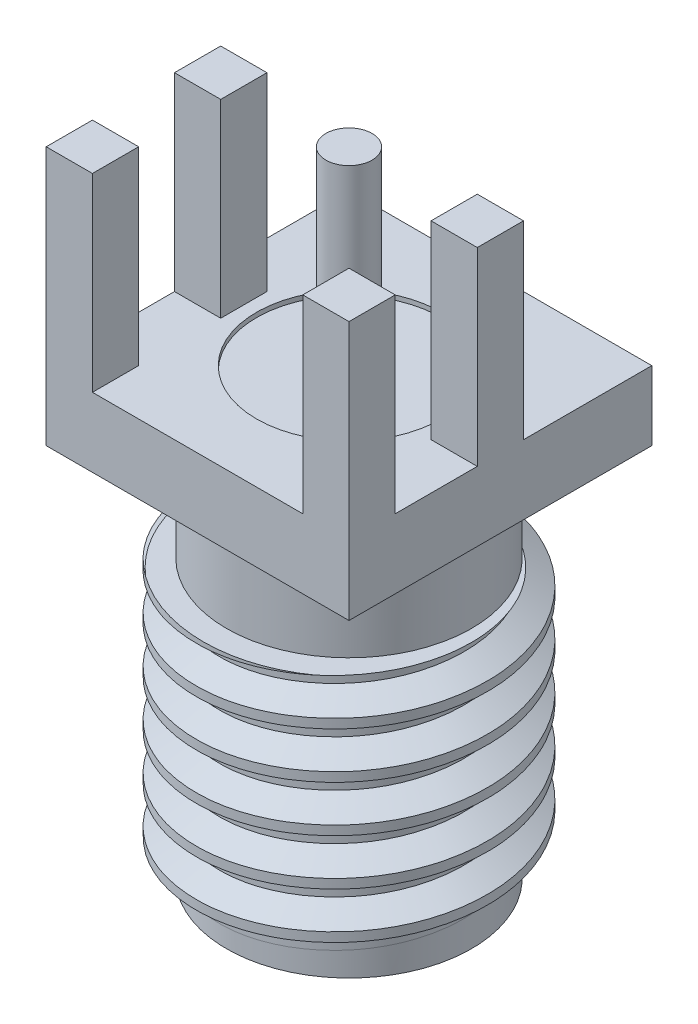
from build123d import *

# Parameters (mm, degrees)
SKETCH1_W           = 6.55
SKETCH1_H           = 6.55
BOSS_EXTRUDE1_DEPTH = 1.5
SKETCH2_W           = 1
SKETCH2_H           = 1
SKETCH2_R           = 0.5
BOSS_EXTRUDE2_DEPTH = 4.1
CUT_EXTRUDE1_START  = -0.1
SKETCH3_R           = 2
SKETCH3_R_2         = 0.5
CUT_EXTRUDE1_DEPTH  = 0.1
SKETCH4_R           = 2.65
BOSS_EXTRUDE3_DEPTH = 8.1
SKETCH5_R           = 2.415
CUT_EXTRUDE2_DEPTH  = 2.25
SKETCH6_R           = 0.25
CUT_EXTRUDE3_DEPTH  = 2
BOSS_EXTRUDE4_START = -6
SKETCH7_R           = 3.15
SKETCH7_R_2         = 2.65
BOSS_EXTRUDE4_DEPTH = 6
CUT_SWEEP3_PITCH    = 1
CUT_EXTRUDE4_START  = -0.8
SKETCH14_R          = 3.15
SKETCH14_R_2        = 2.65
CUT_EXTRUDE4_DEPTH  = 0.8


with BuildPart() as part:
    # Sketch1 → Boss-Extrude1 (new body)
    with BuildSketch(Plane(origin=(0, 0, 0), x_dir=(1, 0, 0), z_dir=(0, 1, 0))):
        Rectangle(SKETCH1_W, SKETCH1_H)
    extrude(amount=BOSS_EXTRUDE1_DEPTH)

    # Sketch2 → Boss-Extrude2 (add)
    with BuildSketch(Plane(origin=(0, 1.5, 0), x_dir=(1, 0, 0), z_dir=(0, 1, 0))):
        with Locations((-2.775, 0)):
            Rectangle(SKETCH2_W, SKETCH2_H)
        with Locations((-2.775, -2.775)):
            Rectangle(SKETCH2_W, SKETCH2_H)
        with Locations((2.775, -2.775)):
            Rectangle(SKETCH2_W, SKETCH2_H)
        with Locations((2.775, 0)):
            Rectangle(SKETCH2_W, SKETCH2_H)
        with Locations(Location((0, 0, 0), (0, 0, 270))):
            Circle(SKETCH2_R)
    extrude(amount=BOSS_EXTRUDE2_DEPTH)

    # Sketch3 → Cut-Extrude1 (cut)
    with BuildSketch(Plane(origin=(0, 1.5, 0), x_dir=(1, 0, 0), z_dir=(0, 1, 0)).offset(CUT_EXTRUDE1_START)):
        with Locations(Location((0, 0, 0), (0, 0, 270))):
            Circle(SKETCH3_R)
        with Locations(Location((0, 0, 0), (0, 0, 270))):
            Circle(SKETCH3_R_2, mode=Mode.SUBTRACT)
    extrude(amount=CUT_EXTRUDE1_DEPTH, mode=Mode.SUBTRACT)

    # Sketch4 → Boss-Extrude3 (add)
    with BuildSketch(Plane.XZ):
        with Locations(Location((0, 0, 0), (0, 0, 90))):
            Circle(SKETCH4_R)
    extrude(amount=BOSS_EXTRUDE3_DEPTH)

    # Sketch5 → Cut-Extrude2 (cut)
    with BuildSketch(Plane.XZ.offset(8.1)):
        with Locations(Location((0, 0, 0), (0, 0, 270))):
            Circle(SKETCH5_R)
    extrude(amount=-CUT_EXTRUDE2_DEPTH, mode=Mode.SUBTRACT)

    # Sketch6 → Cut-Extrude3 (cut)
    with BuildSketch(Plane.XZ.offset(5.85)):
        with Locations(Location((0, 0, 0), (0, 0, 270))):
            Circle(SKETCH6_R)
    extrude(amount=-CUT_EXTRUDE3_DEPTH, mode=Mode.SUBTRACT)

    # Sketch7 → Boss-Extrude4 (add)
    with BuildSketch(Plane.XZ.offset(8.1).offset(BOSS_EXTRUDE4_START)):
        with Locations(Location((0, 0, 0), (0, 0, 270))):
            Circle(SKETCH7_R)
        with Locations(Location((0, 0, 0), (0, 0, 90))):
            Circle(SKETCH7_R_2, mode=Mode.SUBTRACT)
    extrude(amount=BOSS_EXTRUDE4_DEPTH)

    # Cut-Sweep3: the profile of Sketch12 profile screwed along a right-hand helix of 7 turns, 8 arcs to a turn; built about Z, then put on its axis
    cut_sweep3_z = Axis((0, 0, 0), (0, 0, 1))
    cut_sweep3_corners = [(0, 3.15, -0.4), (0, 2.6494, -0.09964), (0, 2.6494, 0.09964), (0, 3.15, 0.4)]
    with BuildLine(mode=Mode.PRIVATE) as cut_sweep3_profile:
        Line(cut_sweep3_corners[0], cut_sweep3_corners[1])
        Line(cut_sweep3_corners[1], cut_sweep3_corners[2])
        Line(cut_sweep3_corners[2], cut_sweep3_corners[3])
        Line(cut_sweep3_corners[3], cut_sweep3_corners[0])
    cut_sweep3_cap = Face(cut_sweep3_profile.wire())
    cut_sweep3_turn_angles = [0, 22.5, 45, 67.5, 90, 112.5, 135, 157.5, 180, 202.5, 225, 247.5, 270, 292.5, 315, 337.5, 360]
    cut_sweep3_turn_weights = [1, 0.9238795325112867, 1, 0.9238795325112867, 1, 0.9238795325112867, 1, 0.9238795325112867, 1, 0.9238795325112867, 1, 0.9238795325112867, 1, 0.9238795325112867, 1, 0.9238795325112867, 1]
    cut_sweep3_turn_rails = [Edge.make_bspline([Vector(p[0], p[1], 0).rotate(cut_sweep3_z, cut_sweep3_turn_angles[k]) / cut_sweep3_turn_weights[k] + Vector(0, 0, p[2] + CUT_SWEEP3_PITCH * cut_sweep3_turn_angles[k] / 360) for k in range(17)], [0, 0, 0, 1, 1, 2, 2, 3, 3, 4, 4, 5, 5, 6, 6, 7, 7, 8, 8, 8], 2, cut_sweep3_turn_weights) for p in cut_sweep3_corners]
    cut_sweep3_turn_sides = [Face.make_surface_from_curves(cut_sweep3_turn_rails[p[0]], cut_sweep3_turn_rails[p[1]]) for p in [(0, 1), (1, 2), (2, 3), (3, 0)]]
    cut_sweep3 = Plane(origin=(0, -8.1, 0), x_dir=(1, 0, 0), z_dir=(0, 1, 0)) * Solid(Shell([*[p.moved(Location((0, 0, CUT_SWEEP3_PITCH * i))) for i in range(7) for p in cut_sweep3_turn_sides], cut_sweep3_cap, cut_sweep3_cap.rotate(cut_sweep3_z, 2520).moved(Location((0, 0, CUT_SWEEP3_PITCH * 2520 / 360)))]))
    add(cut_sweep3, mode=Mode.SUBTRACT)

    # Sketch14 → Cut-Extrude4 (cut)
    with BuildSketch(Plane.XZ.offset(8.1).offset(CUT_EXTRUDE4_START)):
        Circle(SKETCH14_R)
        with Locations(Location((0, 0, 0), (0, 0, 90))):
            Circle(SKETCH14_R_2, mode=Mode.SUBTRACT)
    extrude(amount=CUT_EXTRUDE4_DEPTH, mode=Mode.SUBTRACT)


solid = part.part
